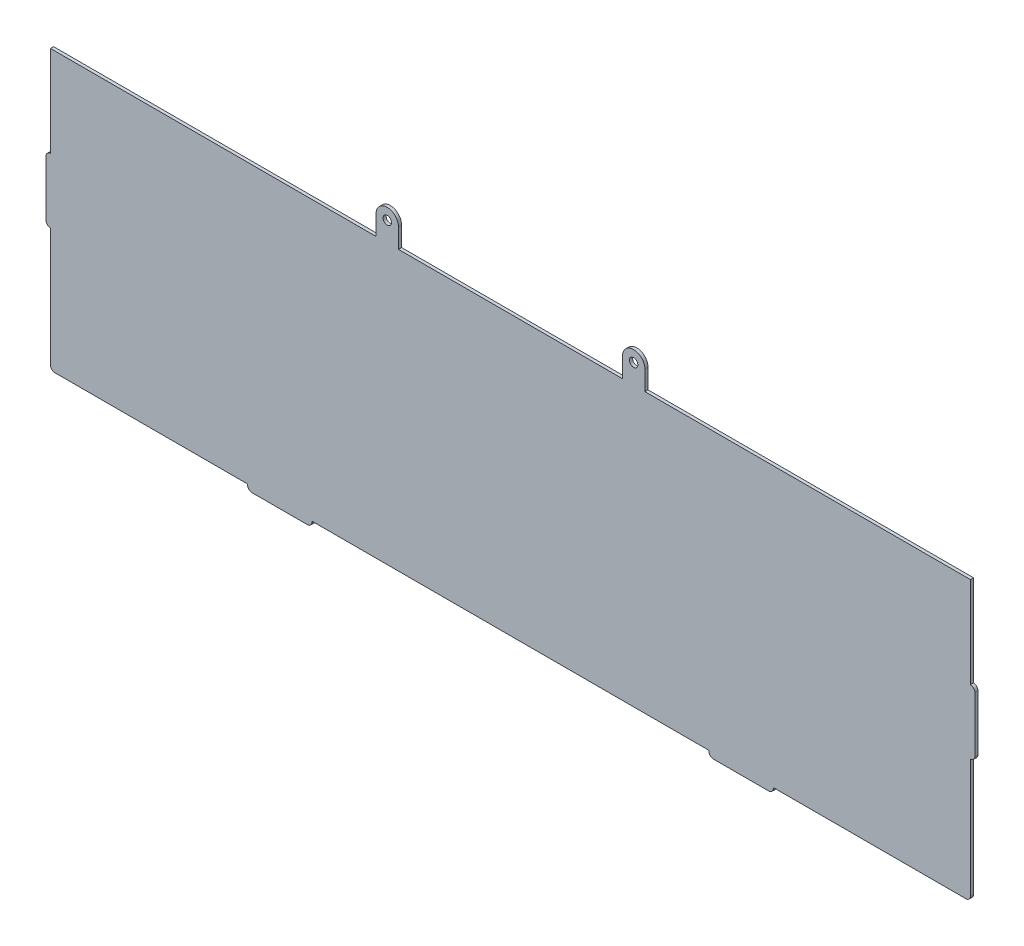
from build123d import *

# Parameters (mm, degrees)
SKETCH1_R           = 2.38125
BOSS_EXTRUDE1_DEPTH = 0.88392
FILLET1_R           = 2.54


with BuildPart() as part:
    # Sketch1 → Boss-Extrude1 (new, symmetric)
    with BuildSketch(Plane.XY):
        with BuildLine():
            Line((-260.731250444, 160.9598), (-76.2, 160.9598))
            Line((-76.2, 160.9598), (-76.2, 172.0723))
            ThreePointArc((-76.2, 172.0723), (-69.85, 178.4223), (-63.5, 172.0723))
            Line((-63.5, 172.0723), (-63.5, 160.9598))
            Line((-63.5, 160.9598), (63.5, 160.9598))
            Line((63.5, 160.9598), (63.5, 172.0723))
            ThreePointArc((63.5, 172.0723), (69.85, 178.4223), (76.2, 172.0723))
            Line((76.2, 172.0723), (76.2, 160.9598))
            Line((76.2, 160.9598), (260.731250444, 160.9598))
            Line((260.731250444, 160.9598), (260.731250444, 109.36605))
            Line((260.731250444, 109.36605), (263.271250444, 109.36605))
            Line((263.271250444, 109.36605), (263.271250444, 72.85355))
            Line((263.271250444, 72.85355), (260.731250444, 72.85355))
            Line((260.731250444, 72.85355), (260.731250444, 3.00355))
            Line((260.731250444, 3.00355), (149.018750222, 3.00355))
            Line((149.018750222, 3.00355), (149.018750222, 0))
            Line((149.018750222, 0), (112.506250222, 0))
            Line((112.506250222, 0), (112.506250222, 3.00355))
            Line((112.506250222, 3.00355), (-112.506250222, 3.00355))
            Line((-112.506250222, 3.00355), (-112.506250222, 0))
            Line((-112.506250222, 0), (-149.018750222, 0))
            Line((-149.018750222, 0), (-149.018750222, 3.00355))
            Line((-149.018750222, 3.00355), (-260.731250444, 3.00355))
            Line((-260.731250444, 3.00355), (-260.731250444, 72.85355))
            Line((-260.731250444, 72.85355), (-263.271250444, 72.85355))
            Line((-263.271250444, 72.85355), (-263.271250444, 109.36605))
            Line((-263.271250444, 109.36605), (-260.731250444, 109.36605))
            Line((-260.731250444, 109.36605), (-260.731250444, 160.9598))
        make_face()
        with Locations(Location((-69.85, 172.0723, 0), (0, 0, 180))):
            Circle(SKETCH1_R, mode=Mode.SUBTRACT)
        with Locations(Location((69.85, 172.0723, 0), (0, 0, 180))):
            Circle(SKETCH1_R, mode=Mode.SUBTRACT)
    extrude(amount=BOSS_EXTRUDE1_DEPTH, both=True)

    # Fillet1
    fillet1_edges = [part.edges().sort_by_distance(p)[0] for p in [
        (-263.271250444, 109.36605, 0),
        (-263.271250444, 72.85355, 0),
        (263.271250444, 109.36605, 0),
        (263.271250444, 72.85355, 0),
        (149.018750222, 0, 0),
        (112.506250222, 0, 0),
        (-112.506250222, 0, 0),
        (-149.018750222, 0, 0),
        (-260.731250444, 3.00355, 0),
        (260.731250444, 3.00355, 0),
    ]]
    fillet(fillet1_edges, radius=FILLET1_R - 0.0001)  # a hair under: the kernel refuses the full size


solid = part.part
